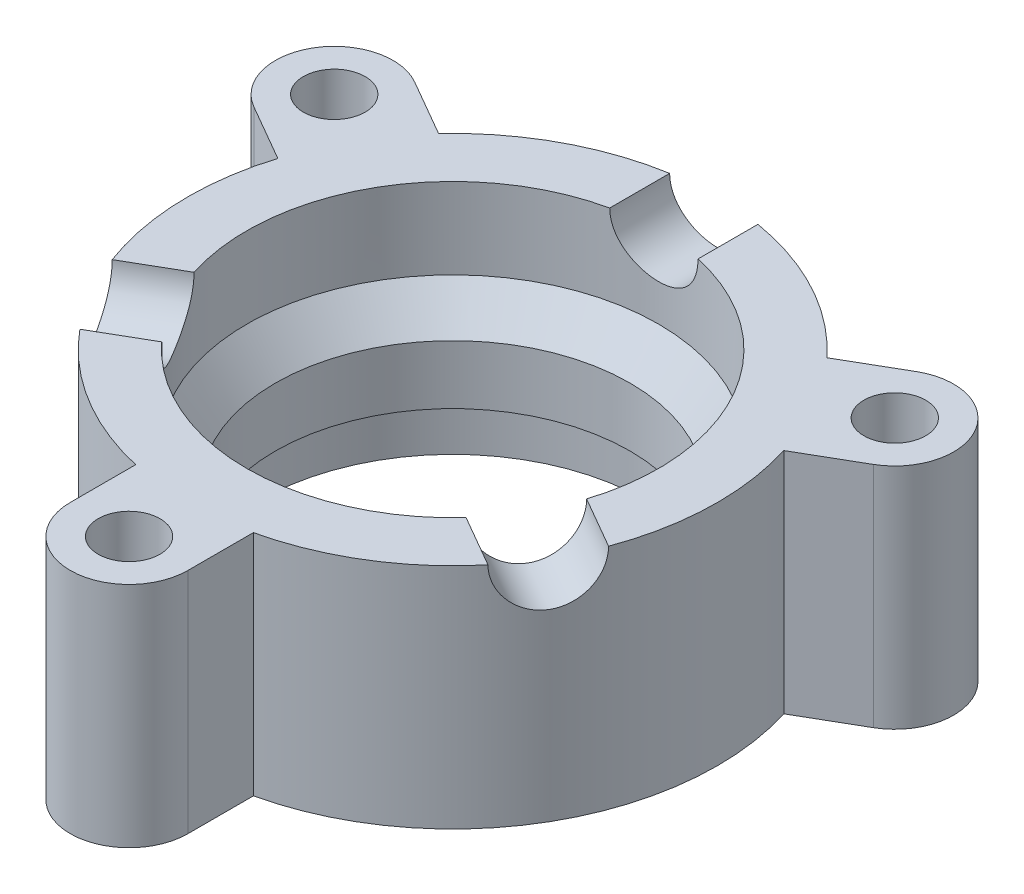
from build123d import *

# Parameters (mm, degrees)
SKETCH1_R               = 2.1
BOSS_EXTRUDE1_DEPTH     = 15.5
SKETCH2_R               = 14
CUT_EXTRUDE1_DEPTH      = 39.04826502
CUT_EXTRUDE2_REACH      = 40.048
CUT_EXTRUDE2_END_RADIUS = 18
SKETCH4_R               = 3
CIRPATTERN1_COUNT       = 3


with BuildPart() as part:
    # Sketch1 → Boss-Extrude1 (new body)
    with BuildSketch(Plane(origin=(0, 0, 0), x_dir=(1, 0, 0), z_dir=(0, 1, 0))):
        with BuildLine():
            ThreePointArc((-4, -22), (0, -26), (4, -22))
            Line((4, -22), (4, -17.549928775))
            ThreePointArc((4, -17.549928775), (15.588457268, -9), (17.198684154, 5.310862772))
            Line((17.198684154, 5.310862772), (21.052558883, 7.535898385))
            ThreePointArc((21.052558883, 7.535898385), (22.516660498, 13), (17.052558883, 14.464101615))
            Line((17.052558883, 14.464101615), (13.198684154, 12.239066003))
            ThreePointArc((13.198684154, 12.239066003), (0, 18), (-13.198684154, 12.239066003))
            Line((-13.198684154, 12.239066003), (-17.052558883, 14.464101615))
            ThreePointArc((-17.052558883, 14.464101615), (-22.516660498, 13), (-21.052558883, 7.535898385))
            Line((-21.052558883, 7.535898385), (-17.198684154, 5.310862772))
            ThreePointArc((-17.198684154, 5.310862772), (-15.588457268, -9), (-4, -17.549928775))
            Line((-4, -17.549928775), (-4, -22))
        make_face()
        with Locations((0, -22)):
            Circle(SKETCH1_R, mode=Mode.SUBTRACT)
        with Locations((-19.052558883, 11)):
            Circle(SKETCH1_R, mode=Mode.SUBTRACT)
        with Locations((19.052558883, 11)):
            Circle(SKETCH1_R, mode=Mode.SUBTRACT)
    extrude(amount=BOSS_EXTRUDE1_DEPTH)

    # Sketch2 → Cut-Extrude1 (cut, through all)
    with BuildSketch(Plane(origin=(0, 15.5, 0), x_dir=(1, 0, 0), z_dir=(0, 1, 0))):
        Circle(SKETCH2_R)
    extrude(amount=-CUT_EXTRUDE1_DEPTH, mode=Mode.SUBTRACT)

    # Sketch3 → Revolve1 (revolve)
    with BuildSketch(Plane.XY):
        Polygon((14, 10), (12.058684154, 7.5), (12.058684154, 3.5), (13.198684154, 3.5), (13.198684154, 0), (14, 0), (14.499168446, 0), (14.499168446, 10), align=None)
    revolve(axis=Axis((0, 0, 0), (0, 1, 0)))

    # Cut-Extrude2: up to this cylinder (the profile starts inside it)
    cut_extrude2_end = Plane(origin=(0, 15.5, 0), z_dir=(0, -1, 0)) * Cylinder(CUT_EXTRUDE2_END_RADIUS, 117.096, mode=Mode.PRIVATE)
    # Sketch4 → Cut-Extrude2 (cut, up to the surface)
    with BuildSketch(Plane.XY, mode=Mode.PRIVATE) as cut_extrude2_sk1:
        with Locations((0, 15.5)):
            Circle(SKETCH4_R)
    cut_extrude2_tool1 = extrude(cut_extrude2_sk1.sketch, amount=-CUT_EXTRUDE2_REACH, mode=Mode.PRIVATE) & cut_extrude2_end
    cut_extrude2 = cut_extrude2_tool1.solids().sort_by_distance((0, 15.5, 0))[0]
    add(cut_extrude2, mode=Mode.SUBTRACT)

    # CirPattern1: Cut-Extrude2 ×3 about axis
    cirpattern1_axis = Axis((0, 0, 0), (0, 1, 0))
    for i in range(1, CIRPATTERN1_COUNT):
        add(cut_extrude2.rotate(cirpattern1_axis, i * 360 / CIRPATTERN1_COUNT), mode=Mode.SUBTRACT)


solid = part.part
